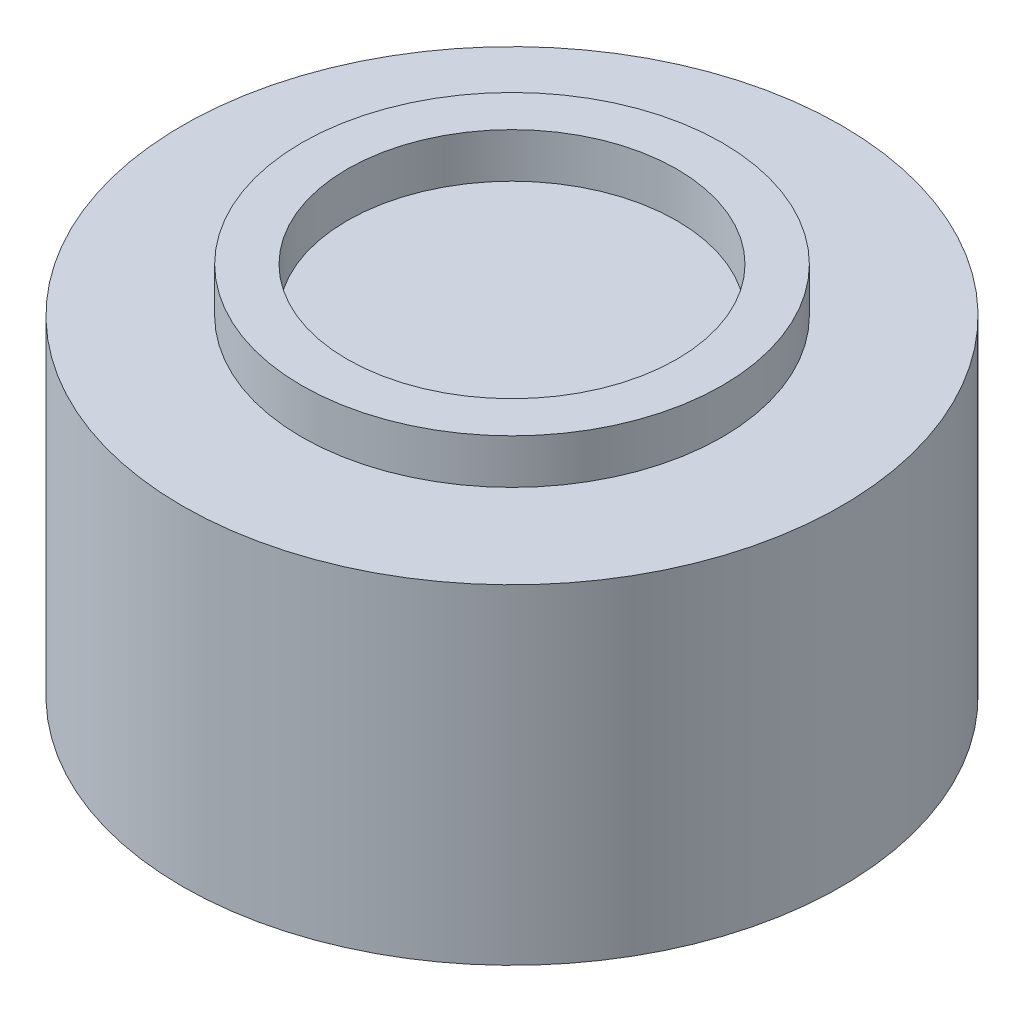
from build123d import *

# Parameters (mm, degrees)
SKETCH1_R           = 6.35
BOSS_EXTRUDE1_DEPTH = 6.35


with BuildPart() as part:
    # Sketch1 → Boss-Extrude1 (new body)
    with BuildSketch(Plane(origin=(0, 0, 0), x_dir=(1, 0, 0), z_dir=(0, 1, 0))):
        Circle(SKETCH1_R)
    extrude(amount=BOSS_EXTRUDE1_DEPTH)


with BuildPart() as body_2:
    # Sketch2 → Revolve1 (revolve)
    with BuildSketch(Plane(origin=(0, 0, 0), x_dir=(0, 0, -1), z_dir=(1, 0, 0))):
        Polygon((-4.051589791, 1.591383686), (-3.175, 1.591383686), (-3.175, 7.210522847), (-4.051589791, 7.210522847), (-4.051589791, 1.858747479), (-6.35, 0), (-6.211066583, 0), align=None)
    revolve(axis=Axis((0, 0, 0), (0, 1, 0)))


solid = Compound([part.part, body_2.part])
